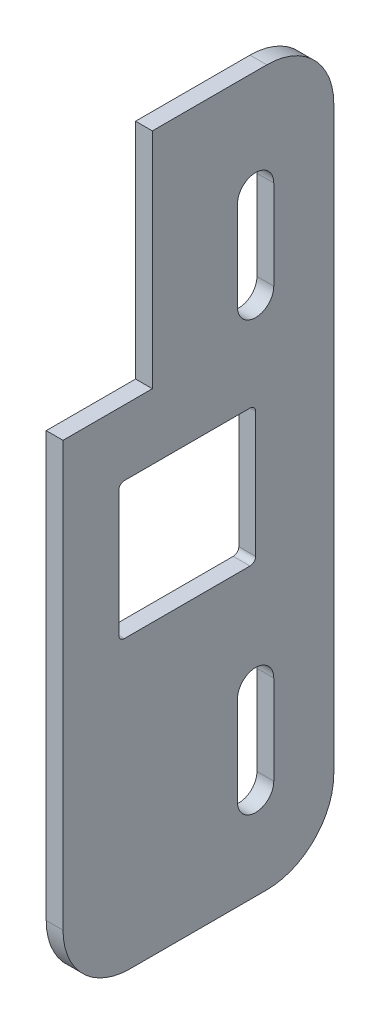
from build123d import *

# Parameters (mm, degrees)
SKETCH1_W          = 76.99375
SKETCH1_H          = 203.2
SKETCH1_W_2        = 38.89375
SKETCH1_H_2        = 38.89375
BASE_FLANGE1_DEPTH = 4.7752
FILLET1_R          = 1.5875
FILLET2_R          = 19.05
SKETCH2_W          = 25.4
SKETCH2_H          = 63.5
CUT_EXTRUDE1_DEPTH = 110.917731513


# Sheet-metal steps are written as plain solids
with BuildPart() as part:
    # Sketch1 → Base-Flange1 (new body)
    with BuildSketch(Plane(origin=(0, 0, 0), x_dir=(0, 0, -1), z_dir=(1, 0, 0))):
        with Locations((3.175, 0)):
            Rectangle(SKETCH1_W, SKETCH1_H)
        Rectangle(SKETCH1_W_2, SKETCH1_H_2, mode=Mode.SUBTRACT)
        with BuildLine():
            Line((24.60625, 71.496159823), (24.60625, 46.096159823))
            ThreePointArc((24.60625, 46.096159823), (19.446875, 40.936784823), (14.2875, 46.096159823))
            Line((14.2875, 46.096159823), (14.2875, 71.496159823))
            ThreePointArc((14.2875, 71.496159823), (19.446875, 76.655534823), (24.60625, 71.496159823))
        make_face(mode=Mode.SUBTRACT)
        with BuildLine():
            Line((24.60625, -75.803125), (24.60625, -50.403125))
            ThreePointArc((24.60625, -50.403125), (19.446875, -45.24375), (14.2875, -50.403125))
            Line((14.2875, -50.403125), (14.2875, -75.803125))
            ThreePointArc((14.2875, -75.803125), (19.446875, -80.9625), (24.60625, -75.803125))
        make_face(mode=Mode.SUBTRACT)
    extrude(amount=-BASE_FLANGE1_DEPTH)

    # Fillet1
    fillet1_edges = [part.edges().sort_by_distance(p)[0] for p in [
        (-2.3876, -19.446875, 19.446875),
        (-2.3876, 19.446875, 19.446875),
        (-2.3876, 19.446875, -19.446875),
        (-2.3876, -19.446875, -19.446875),
    ]]
    fillet(fillet1_edges, radius=FILLET1_R)

    # Fillet2
    fillet2_edges = [part.edges().sort_by_distance(p)[0] for p in [
        (-2.3876, -101.6, -41.671875),
        (-2.3876, -101.6, 35.321875),
        (-2.3876, 101.6, 35.321875),
        (-2.3876, 101.6, -41.671875),
    ]]
    fillet(fillet2_edges, radius=FILLET2_R)

    # Sketch2 → Cut-Extrude1 (cut, through all)
    with BuildSketch(Plane.ZY.offset(4.7752)):
        with Locations((22.621875, 69.85)):
            Rectangle(SKETCH2_W, SKETCH2_H)
    extrude(amount=-CUT_EXTRUDE1_DEPTH, mode=Mode.SUBTRACT)


solid = part.part
